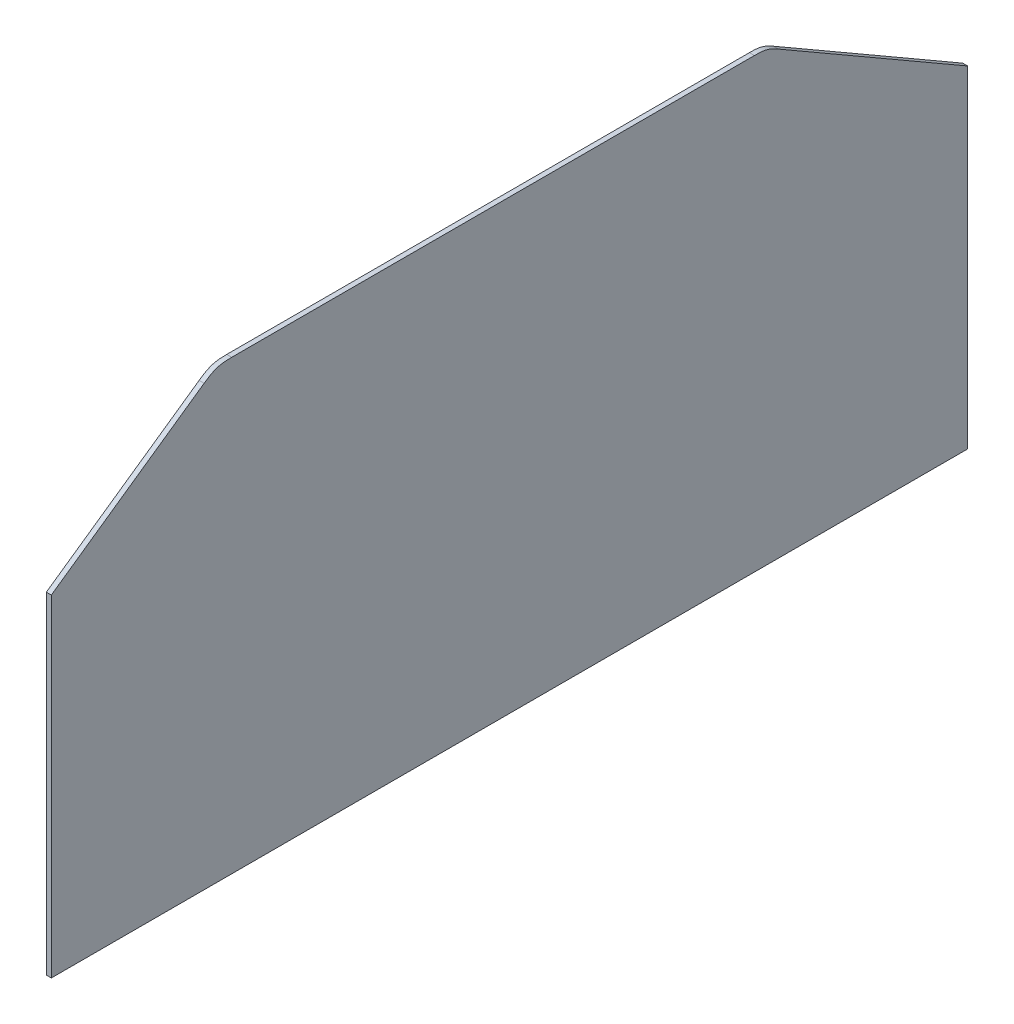
from build123d import *

# Parameters (mm, degrees)
BASE_FLANGE1_DEPTH = 2.588


# Sheet-metal steps are written as plain solids
with BuildPart() as part:
    # Base-Flange1: sheet metal written as solids
    # Sketch1 → Base-Flange1 (new body)
    with BuildSketch(Plane(origin=(0, 0, 0), x_dir=(0, 0, -1), z_dir=(1, 0, 0))):
        Polygon((0, 172), (85.688880405, 232), (371.300951546, 232), (475.224, 172), (475.224, 0), (0, 0), align=None)
    extrude(amount=-BASE_FLANGE1_DEPTH)

    # Fillet1
    # a fillet whose section is not a circle: 25 mm, written as the material it takes off along each edge
    with BuildSketch(Plane(origin=(19.706174305, 232, -85.688880405), x_dir=(0, -0.5735764363510439, 0.8191520442889934), z_dir=(-1, 0, 0))) as fillet1_piece_1:
        with BuildLine():
            add(Edge.make_bspline([(7.882469722, 0), (6.425514187, 0), (4.968558652, 0), (1.72149306, -0.207126843), (-1.291361483, -1.157076231), (-4.070004977, -2.849848165), (-5.263473082, -3.685523529), (-6.456941187, -4.521198893)], knots=[0, 0, 0, 0, 0, 0, 0.5, 0.5, 1, 1, 1, 1, 1, 1], degree=5))
            Line((-6.456941187, -4.521198893), (0, 0))
            Line((0, 0), (7.882469722, 0))
        make_face()
    extrude(amount=42.00034861, mode=Mode.SUBTRACT)
    with BuildSketch(Plane(origin=(16.746824527, 232, -371.300951546), x_dir=(0, 0, 1), z_dir=(-1, 0, 0))) as fillet1_piece_2:
        with BuildLine():
            add(Edge.make_bspline([(6.698729811, 0), (5.455779776, 0), (4.212829741, 0), (1.444392876, -0.149716053), (-1.176022897, -0.851854343), (-3.648417578, -2.106414871), (-4.724843884, -2.727889888), (-5.801270189, -3.349364905)], knots=[0, 0, 0, 0, 0, 0, 0.5, 0.5, 1, 1, 1, 1, 1, 1], degree=5))
            Line((-5.801270189, -3.349364905), (0, 0))
            Line((0, 0), (6.698729811, 0))
        make_face()
    extrude(amount=36.081649054, mode=Mode.SUBTRACT)


solid = part.part
